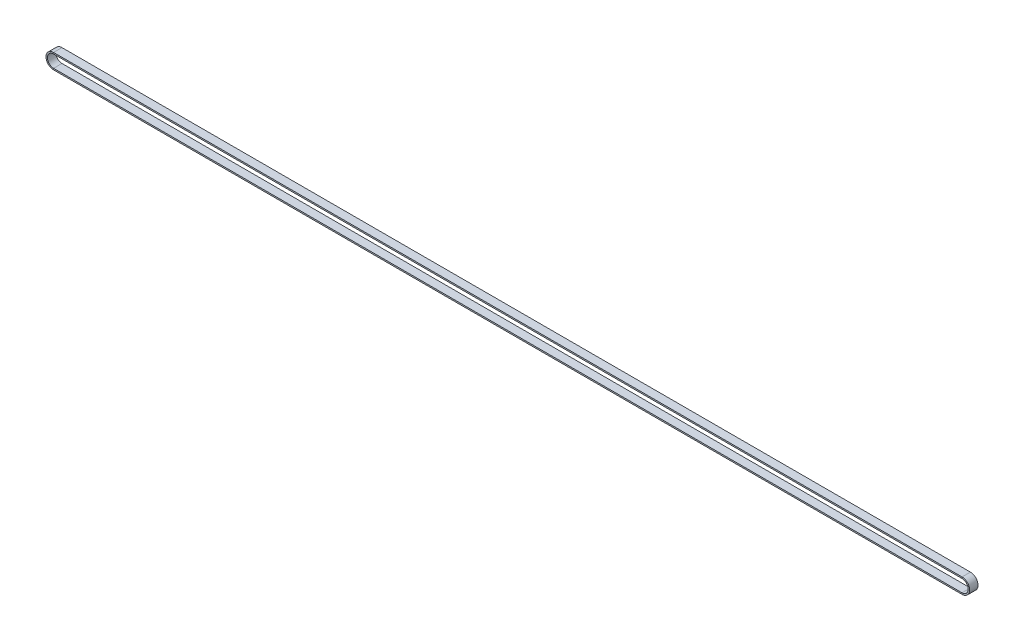
from build123d import *

# Parameters (mm, degrees)
SKETCH3_W = 9
SKETCH3_H = 1.5


with BuildPart() as part:
    # Sweep1: sweep along a path in Sketch2
    with BuildLine(Plane.XY) as sweep1_path:
        Line((-0.000133631, 98.304166585), (-976.331033951, 98.304166585))
        ThreePointArc((-976.331033951, 98.304166585), (-984.470783951, 106.443916585), (-976.331033951, 114.583666585))
        Line((-976.331033951, 114.583666585), (-0.000133631, 114.583666585))
        ThreePointArc((-0.000133631, 114.583666585), (8.139616369, 106.443916585), (-0.000133631, 98.304166585))
    # Sketch3 → Sweep1 (sweep)
    with BuildSketch(Plane(origin=(-0.000133631, 114.583666585, 0), x_dir=(0, 0, -1), z_dir=(1, 0, 0))):
        with Locations((4.5, -0.75)):
            Rectangle(SKETCH3_W, SKETCH3_H)
    sweep(path=sweep1_path.line)


solid = part.part
